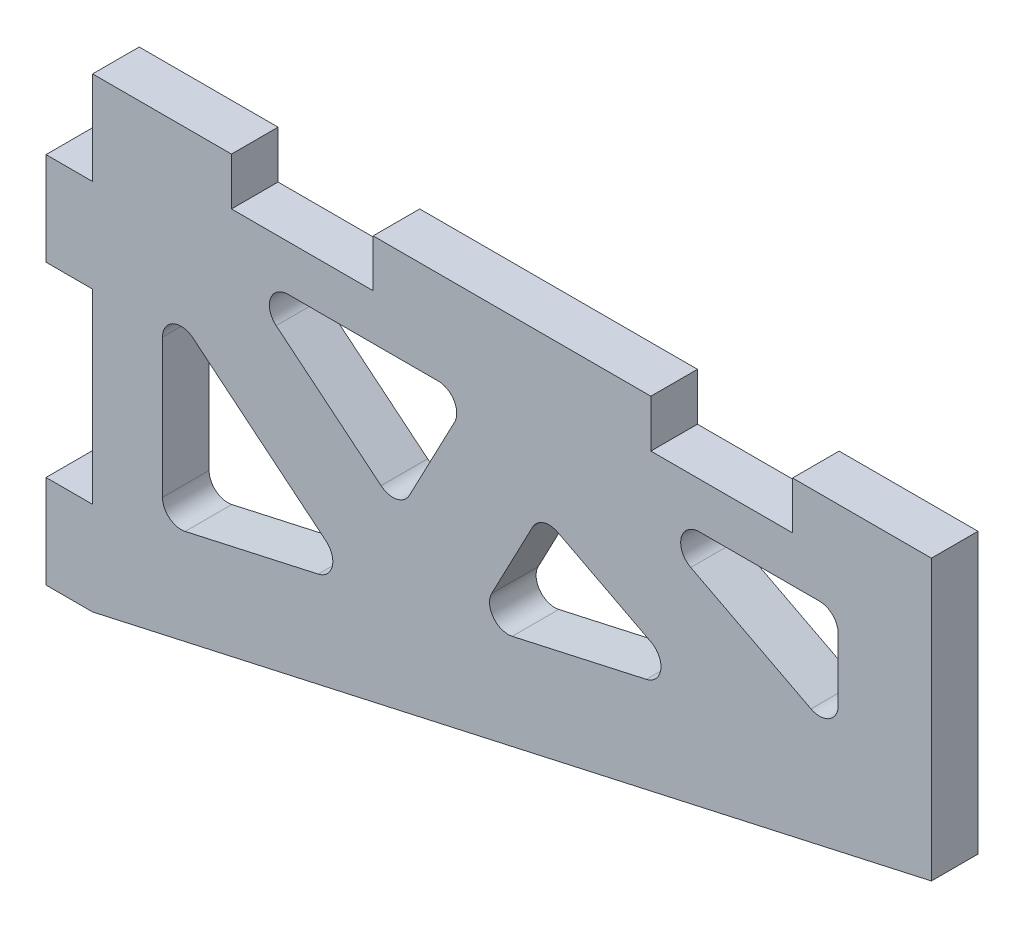
from build123d import *

# Parameters (mm, degrees)
BOSS_EXTRUDE1_DEPTH = 6.35
CUT_EXTRUDE1_DEPTH  = 6.35
FILLET1_R           = 2.54


with BuildPart() as part:
    # Sketch2 → Boss-Extrude1 (new body)
    with BuildSketch(Plane.XY):
        Polygon((-6.35, -63.5), (0, -63.5), (114.3, -38.1), (114.3, 0), (95.377, 0), (95.377, -6.477), (76.073, -6.477), (76.073, 0), (38.227, 0), (38.227, -6.477), (18.923, -6.477), (18.923, 0), (0, 0), (0, -12.7), (-6.35, -12.7), (-6.35, -25.4), (0, -25.4), (0, -50.8), (-6.35, -50.8), align=None)
    extrude(amount=-BOSS_EXTRUDE1_DEPTH)

    # Sketch3 → Cut-Extrude1 (cut)
    with BuildSketch(Plane.XY):
        Polygon((35.837567759, -42.526294431), (9.525, -20.916959432), (9.525, -48.37353171), align=None)
        Polygon((51.284246094, -12.7), (19.530365822, -12.7), (41.715916793, -30.920000703), align=None)
        Polygon((61.141826863, -21.244462208), (51.832146694, -38.971943556), (82.284813735, -32.204684214), align=None)
        Polygon((101.6, -12.7), (72.25424324, -12.7), (101.6, -27.912420599), align=None)
    extrude(amount=-CUT_EXTRUDE1_DEPTH, mode=Mode.SUBTRACT)

    # Fillet1
    fillet1_edges = [part.edges().sort_by_distance(p)[0] for p in [
        (82.284813735, -32.204684214, -3.175),
        (51.832146694, -38.971943556, -3.175),
        (61.141826863, -21.244462208, -3.175),
        (101.6, -27.912420599, -3.175),
        (72.25424324, -12.7, -3.175),
        (101.6, -12.7, -3.175),
        (35.837567759, -42.526294431, -3.175),
        (9.525, -20.916959432, -3.175),
        (51.284246094, -12.7, -3.175),
        (41.715916793, -30.920000703, -3.175),
        (19.530365822, -12.7, -3.175),
        (9.525, -48.37353171, -3.175),
    ]]
    fillet(fillet1_edges, radius=FILLET1_R)


solid = part.part
